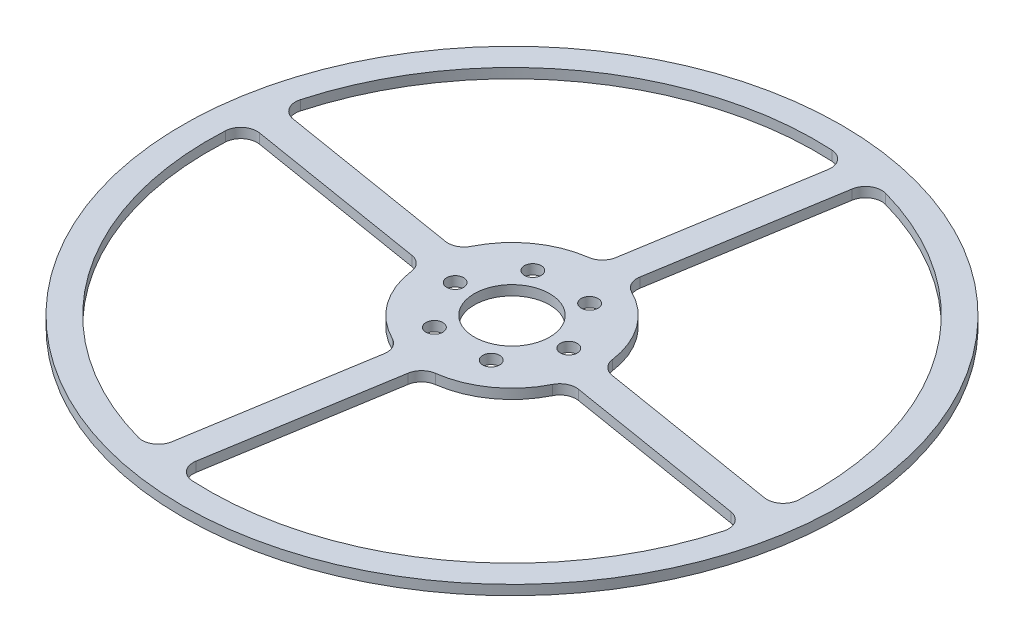
from build123d import *

# Parameters (mm, degrees)
BOSS_EXTRUDE1_DEPTH = 3.02
CIRPATTERN1_COUNT   = 2
SKETCH1_R           = 2.6
SKETCH1_R_2         = 11.6
CUT_EXTRUDE2_DEPTH  = 144.574442015


with BuildPart() as part:
    # Sketch2 → Boss-Extrude1 (new body)
    with BuildSketch(Plane(origin=(0, 0, 0), x_dir=(1, 0, 0), z_dir=(0, 1, 0))):
        with BuildLine():
            ThreePointArc((-6.115404712, 101.315605043), (-15.155910269, -100.362086387), (35.760248923, 94.991865952))
            ThreePointArc((35.760248923, 94.991865952), (15.155910269, 100.362086387), (-6.115404712, 101.315605043))
        make_face()
        with BuildLine():
            Line((9.783940509, 87.558691791), (0.583852676, 31.399189736))
            ThreePointArc((0.583852676, 31.399189736), (-0.864894505, 28.622629997), (-3.681086724, 27.25251549))
            ThreePointArc((-3.681086724, 27.25251549), (-16.04598265, 22.333303401), (-24.65342824, 12.184353739))
            ThreePointArc((-24.65342824, 12.184353739), (-26.850510178, 9.952542068), (-29.944198308, 9.465462887))
            Line((-29.944198308, 9.465462887), (-86.103700364, 18.665550721))
            ThreePointArc((-86.103700364, 18.665550721), (-89.50691556, 20.904801974), (-90.114319352, 24.933099442))
            ThreePointArc((-90.114319352, 24.933099442), (-54.556341009, 75.933231564), (5.123707677, 93.359507388))
            ThreePointArc((5.123707677, 93.359507388), (8.747630262, 91.498511701), (9.783940509, 87.558691791))
        make_face(mode=Mode.SUBTRACT)
        with BuildLine():
            Line((18.665550721, 86.103700364), (9.465462887, 29.944198308))
            ThreePointArc((9.465462887, 29.944198308), (9.952542068, 26.850510178), (12.184353739, 24.65342824))
            ThreePointArc((12.184353739, 24.65342824), (16.04598265, -22.333303401), (-27.25251549, -3.681086724))
            ThreePointArc((-27.25251549, -3.681086724), (-28.622629997, -0.864894505), (-31.399189736, 0.583852676))
            Line((-31.399189736, 0.583852676), (-87.558691791, 9.783940509))
            ThreePointArc((-87.558691791, 9.783940509), (-91.498511701, 8.747630262), (-93.359507388, 5.123707677))
            ThreePointArc((-93.359507388, 5.123707677), (54.556341009, -75.933231564), (24.933099442, 90.114319352))
            ThreePointArc((24.933099442, 90.114319352), (20.904801974, 89.50691556), (18.665550721, 86.103700364))
        make_face(mode=Mode.SUBTRACT)
    extrude(amount=BOSS_EXTRUDE1_DEPTH)


with BuildPart() as cirpattern1_1:
    # CirPattern1: pattern copy
    add(part.part.rotate(Axis((0, -0.15, 0), (0, 1, 0)), 1 * 360 / CIRPATTERN1_COUNT))


with BuildPart() as part_1:
    add(part.part)

    # Combine1: union CirPattern1_1
    add(cirpattern1_1.part)

    # Sketch1 → Cut-Extrude2 (cut, through all)
    with BuildSketch(Plane(origin=(0, 0, 0), x_dir=(1, 0, 0), z_dir=(0, 1, 0))):
        with Locations((8.75, 15.155444566)):
            Circle(SKETCH1_R)
        with Locations((17.5, 0)):
            Circle(SKETCH1_R)
        with Locations((8.75, -15.155444566)):
            Circle(SKETCH1_R)
        with Locations((-8.75, -15.155444566)):
            Circle(SKETCH1_R)
        with Locations((-17.5, 0)):
            Circle(SKETCH1_R)
        with Locations((-8.75, 15.155444566)):
            Circle(SKETCH1_R)
        Circle(SKETCH1_R_2)
    extrude(amount=CUT_EXTRUDE2_DEPTH, mode=Mode.SUBTRACT)


solid = part_1.part
